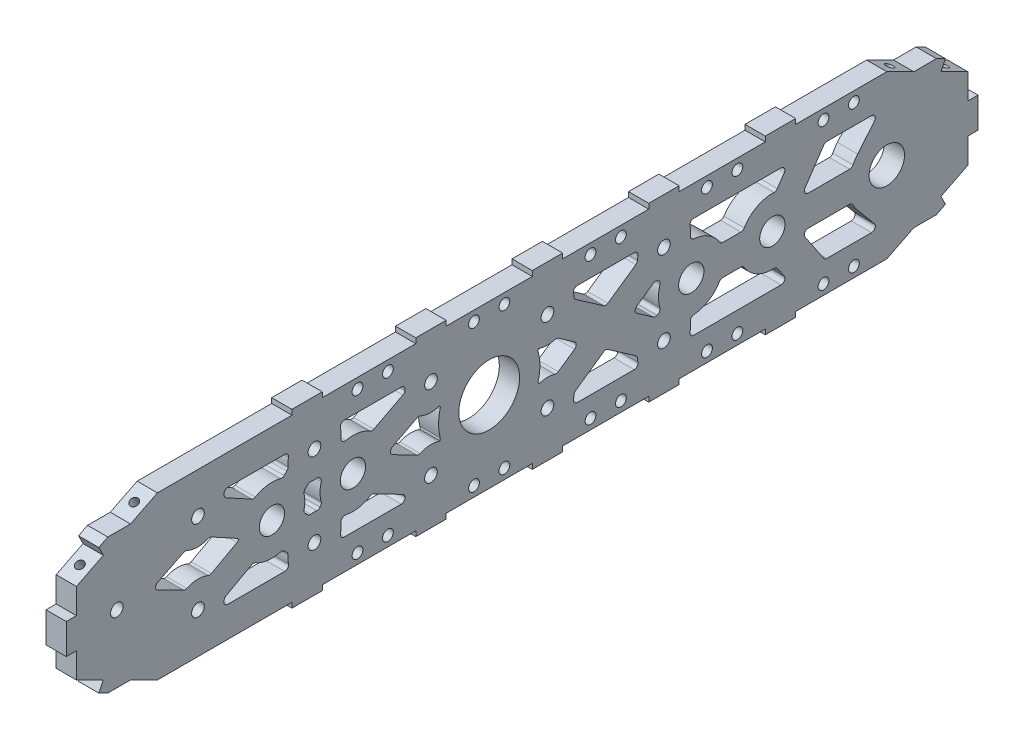
from build123d import *

# Parameters (mm, degrees)
SKETCH1_R                   = 7.9375
BOSS_EXTRUDE1_DEPTH         = 12.7
F_3_8_16_TAPPED_HOLE1_D     = 7.9375
F_3_8_16_TAPPED_HOLE1_DEPTH = 23.876
F_3_8_16_TAPPED_HOLE1_TIP   = 2.384665582
CUT_EXTRUDE3_DEPTH          = 218.842023092
BOSS_EXTRUDE2_DEPTH         = 12.7
CUT_EXTRUDE4_DEPTH          = 218.842023092
SKETCH13_W                  = 25.4
SKETCH13_H                  = 101.6
BOSS_EXTRUDE3_DEPTH         = 12.7
SKETCH14_R                  = 11.1125
CUT_EXTRUDE5_DEPTH          = 352.269809441
F_3_8_16_TAPPED_HOLE2_D     = 7.9375
F_3_8_16_TAPPED_HOLE2_DEPTH = 23.876
F_3_8_16_TAPPED_HOLE2_TIP   = 2.384665582
SKETCH17_R                  = 19.05
CUT_EXTRUDE6_DEPTH          = 352.269809441
F_1_4_CLEARANCE_HOLE1_D     = 6.7564
SKETCH21_W                  = 19.05
SKETCH21_H                  = 3.175
BOSS_EXTRUDE4_DEPTH         = 12.7
SKETCH22_W                  = 6.35
SKETCH22_H                  = 19.05
BOSS_EXTRUDE5_DEPTH         = 12.7
F_1_4_20_TAPPED_HOLE1_D     = 5.1054
F_1_4_20_TAPPED_HOLE1_DEPTH = 22.86
F_1_4_20_TAPPED_HOLE1_TIP   = 1.533816902
F_1_4_20_TAPPED_HOLE2_D     = 5.1054
F_1_4_20_TAPPED_HOLE2_DEPTH = 22.86
F_1_4_20_TAPPED_HOLE2_TIP   = 1.533816902
F_1_4_20_TAPPED_HOLE3_D     = 5.1054
F_1_4_20_TAPPED_HOLE3_DEPTH = 22.86
F_1_4_20_TAPPED_HOLE3_TIP   = 1.533816902
F_1_4_20_TAPPED_HOLE4_D     = 5.1054
F_1_4_20_TAPPED_HOLE4_DEPTH = 22.86
F_1_4_20_TAPPED_HOLE4_TIP   = 1.533816902
CUT_EXTRUDE7_DEPTH          = 359.015004783
FILLET1_R                   = 2.38125
BOSS_EXTRUDE6_DEPTH         = 12.7


with BuildPart() as part:
    # Sketch1 → Boss-Extrude1 (new body)
    with BuildSketch(Plane(origin=(0, 0, 0), x_dir=(0, 0, -1), z_dir=(1, 0, 0))):
        with BuildLine():
            Line((93.345, 0), (55.245, 50.8))
            Line((55.245, 50.8), (-160.655, 50.8))
            ThreePointArc((-160.655, 50.8), (-211.455, 0), (-160.655, -50.8))
            Line((-160.655, -50.8), (55.245, -50.8))
            Line((55.245, -50.8), (93.345, 0))
        make_face()
        with Locations((-88.9, 0)):
            Circle(SKETCH1_R, mode=Mode.SUBTRACT)
        with Locations((-38.1, 0)):
            Circle(SKETCH1_R, mode=Mode.SUBTRACT)
    boss_extrude1 = extrude(amount=BOSS_EXTRUDE1_DEPTH)

    # 3/8-16 Tapped Hole1
    with Locations(Plane(origin=(12.7, 0, 0), x_dir=(0, 0, -1), z_dir=(1, 0, 0))):
        with Locations((61.595, 0), (-62.23, -25.4), (-135.255, -25.4), (-62.23, 25.4), (-135.255, 25.4), (-186.055, 0)):
            Hole(F_3_8_16_TAPPED_HOLE1_D / 2, depth=F_3_8_16_TAPPED_HOLE1_DEPTH)
            with Locations((0, 0, -(F_3_8_16_TAPPED_HOLE1_DEPTH + F_3_8_16_TAPPED_HOLE1_TIP / 2))):  # 118° drill point
                Cone(0, F_3_8_16_TAPPED_HOLE1_D / 2, F_3_8_16_TAPPED_HOLE1_TIP, mode=Mode.SUBTRACT)

    # Sketch10 → Cut-Extrude3 (cut, through all)
    with BuildSketch(Plane(origin=(12.7, 0, 0), x_dir=(0, 0, -1), z_dir=(1, 0, 0))):
        Polygon((-211.455, 25.4), (-160.655, 50.8), (-211.455, 50.8), align=None)
        Polygon((-211.455, -25.4), (-160.655, -50.8), (-211.455, -50.8), align=None)
    cut_extrude3 = extrude(amount=-CUT_EXTRUDE3_DEPTH, mode=Mode.SUBTRACT)

    # Sketch11 → Boss-Extrude2 (add)
    with BuildSketch(Plane(origin=(12.7, 0, 0), x_dir=(0, 0, -1), z_dir=(1, 0, 0))):
        Polygon((-201.295, 30.48), (-211.455, 25.4), (-211.455, -25.4), (-201.295, -30.48), align=None)
    boss_extrude2 = extrude(amount=-BOSS_EXTRUDE2_DEPTH)

    # Sketch12 → Cut-Extrude4 (cut, through all)
    with BuildSketch(Plane.ZY):
        Polygon((-67.945, 33.866666667), (-67.945, -33.866666667), (-93.345, 0), align=None)
    extrude(amount=-CUT_EXTRUDE4_DEPTH, mode=Mode.SUBTRACT)

    # Mirror1: Boss-Extrude1, Cut-Extrude3, Boss-Extrude2 across plane
    add(boss_extrude1.mirror(Plane(origin=(12.7, 33.866666667, -67.945), x_dir=(1, 0, 0), z_dir=(0, 0, 1))))
    add(cut_extrude3.mirror(Plane(origin=(12.7, 33.866666667, -67.945), x_dir=(1, 0, 0), z_dir=(0, 0, 1))), mode=Mode.SUBTRACT)
    add(boss_extrude2.mirror(Plane(origin=(12.7, 33.866666667, -67.945), x_dir=(1, 0, 0), z_dir=(0, 0, 1))))

    # Sketch13 → Boss-Extrude3 (add)
    with BuildSketch(Plane(origin=(12.7, 0, 0), x_dir=(0, 0, -1), z_dir=(1, 0, 0))):
        with Locations((67.945, 0)):
            Rectangle(SKETCH13_W, SKETCH13_H)
    extrude(amount=-BOSS_EXTRUDE3_DEPTH)

    # Sketch14 → Cut-Extrude5 (cut, through all)
    with BuildSketch(Plane.ZY):
        with Locations((-296.545, 0)):
            Circle(SKETCH14_R)
    extrude(amount=-CUT_EXTRUDE5_DEPTH, mode=Mode.SUBTRACT)

    # 3/8-16 Tapped Hole2
    with Locations(Plane(origin=(12.7, 0, 0), x_dir=(0, 0, -1), z_dir=(1, 0, 0))):
        with Locations((10.795, 25.4), (83.82, 25.4), (156.845, 25.4), (10.795, -25.4), (83.82, -25.4), (156.845, -25.4)):
            Hole(F_3_8_16_TAPPED_HOLE2_D / 2, depth=F_3_8_16_TAPPED_HOLE2_DEPTH)
            with Locations((0, 0, -(F_3_8_16_TAPPED_HOLE2_DEPTH + F_3_8_16_TAPPED_HOLE2_TIP / 2))):  # 118° drill point
                Cone(0, F_3_8_16_TAPPED_HOLE2_D / 2, F_3_8_16_TAPPED_HOLE2_TIP, mode=Mode.SUBTRACT)

    # Sketch17 → Cut-Extrude6 (cut, through all)
    with BuildSketch(Plane(origin=(12.7, 0, 0), x_dir=(0, 0, -1), z_dir=(1, 0, 0))):
        with Locations((47.3075, 0)):
            Circle(SKETCH17_R)
    extrude(amount=-CUT_EXTRUDE6_DEPTH, mode=Mode.SUBTRACT)

    # 1/4 Clearance Hole1 (through all)
    with Locations(Plane(origin=(12.7, 0, 0), x_dir=(0, 0, -1), z_dir=(1, 0, 0))):
        with Locations((-35.2425, 44.45), (-16.1925, 44.45), (37.7825, 44.45), (56.8325, 44.45), (110.8075, 44.45), (129.8575, 44.45), (183.8325, 44.45), (202.8825, 44.45), (256.8575, 44.45), (275.9075, 44.45)):
            f_1_4_clearance_hole1 = Hole(F_1_4_CLEARANCE_HOLE1_D / 2)

    # Sketch21 → Boss-Extrude4 (add)
    with BuildSketch(Plane(origin=(12.7, 0, 0), x_dir=(0, 0, -1), z_dir=(1, 0, 0))):
        with Locations((-66.83375, 52.3875)):
            Rectangle(SKETCH21_W, SKETCH21_H)
        with Locations((10.795, 52.3875)):
            Rectangle(SKETCH21_W, SKETCH21_H)
        with Locations((83.82, 52.3875)):
            Rectangle(SKETCH21_W, SKETCH21_H)
        with Locations((156.845, 52.3875)):
            Rectangle(SKETCH21_W, SKETCH21_H)
        with Locations((229.87, 52.3875)):
            Rectangle(SKETCH21_W, SKETCH21_H)
    boss_extrude4 = extrude(amount=-BOSS_EXTRUDE4_DEPTH)

    # Mirror2: 1/4 Clearance Hole1, Boss-Extrude4 across plane
    add(f_1_4_clearance_hole1.mirror(Plane.ZX), mode=Mode.SUBTRACT)
    add(boss_extrude4.mirror(Plane.ZX))

    # Sketch22 → Boss-Extrude5 (add)
    with BuildSketch(Plane(origin=(12.7, 0, 0), x_dir=(0, 0, -1), z_dir=(1, 0, 0))):
        Polygon((-197.414225326, 39.519903166), (-194.574418994, 33.840290503), (-177.535581006, 42.359709497), (-191.734612663, 42.359709497), align=None)
        with Locations((-214.63, 0)):
            Rectangle(SKETCH22_W, SKETCH22_H)
        Polygon((-177.535581006, -42.359709497), (-194.574418994, -33.840290503), (-197.414225326, -39.519903166), (-191.734612663, -42.359709497), align=None)
        Polygon((330.464418994, -33.840290503), (313.425581006, -42.359709497), (327.624612663, -42.359709497), (333.304225326, -39.519903166), align=None)
        with Locations((350.52, 0)):
            Rectangle(SKETCH22_W, SKETCH22_H)
        Polygon((313.425581006, 42.359709497), (330.464418994, 33.840290503), (333.304225326, 39.519903166), (327.624612663, 42.359709497), align=None)
    extrude(amount=-BOSS_EXTRUDE5_DEPTH)

    # 1/4-20 Tapped Hole1
    with Locations(Plane(origin=(0, -104.902, 52.451), x_dir=(-1, 0, 0), z_dir=(0, -0.8944271909999177, 0.4472135954999544))):
        with Locations((-6.35, -130.146876347), (-6.35, -168.246876347)):
            Hole(F_1_4_20_TAPPED_HOLE1_D / 2, depth=F_1_4_20_TAPPED_HOLE1_DEPTH)
            with Locations((0, 0, -(F_1_4_20_TAPPED_HOLE1_DEPTH + F_1_4_20_TAPPED_HOLE1_TIP / 2))):  # 118° drill point
                Cone(0, F_1_4_20_TAPPED_HOLE1_D / 2, F_1_4_20_TAPPED_HOLE1_TIP, mode=Mode.SUBTRACT)

    # 1/4-20 Tapped Hole2
    with Locations(Plane(origin=(0, 104.902, 52.451), x_dir=(1, 0, 0), z_dir=(0, 0.894427190999916, 0.44721359549995787))):
        with Locations((6.35, -130.146876347), (6.35, -168.246876347)):
            Hole(F_1_4_20_TAPPED_HOLE2_D / 2, depth=F_1_4_20_TAPPED_HOLE2_DEPTH)
            with Locations((0, 0, -(F_1_4_20_TAPPED_HOLE2_DEPTH + F_1_4_20_TAPPED_HOLE2_TIP / 2))):  # 118° drill point
                Cone(0, F_1_4_20_TAPPED_HOLE2_D / 2, F_1_4_20_TAPPED_HOLE2_TIP, mode=Mode.SUBTRACT)

    # 1/4-20 Tapped Hole3
    with Locations(Plane(origin=(0, -159.258, -79.629), x_dir=(-1, 0, 0), z_dir=(0, -0.8944271909999177, -0.4472135954999544))):
        with Locations((-6.35, 289.790587332), (-6.35, 251.690587332)):
            Hole(F_1_4_20_TAPPED_HOLE3_D / 2, depth=F_1_4_20_TAPPED_HOLE3_DEPTH)
            with Locations((0, 0, -(F_1_4_20_TAPPED_HOLE3_DEPTH + F_1_4_20_TAPPED_HOLE3_TIP / 2))):  # 118° drill point
                Cone(0, F_1_4_20_TAPPED_HOLE3_D / 2, F_1_4_20_TAPPED_HOLE3_TIP, mode=Mode.SUBTRACT)

    # 1/4-20 Tapped Hole4
    with Locations(Plane(origin=(0, 159.258, -79.629), x_dir=(1, 0, 0), z_dir=(0, 0.894427190999916, -0.44721359549995787))):
        with Locations((6.35, 251.690587332), (6.35, 289.790587332)):
            Hole(F_1_4_20_TAPPED_HOLE4_D / 2, depth=F_1_4_20_TAPPED_HOLE4_DEPTH)
            with Locations((0, 0, -(F_1_4_20_TAPPED_HOLE4_DEPTH + F_1_4_20_TAPPED_HOLE4_TIP / 2))):  # 118° drill point
                Cone(0, F_1_4_20_TAPPED_HOLE4_D / 2, F_1_4_20_TAPPED_HOLE4_TIP, mode=Mode.SUBTRACT)

    # Sketch31 → Cut-Extrude7 (cut, through all)
    with BuildSketch(Plane(origin=(12.7, 0, 0), x_dir=(0, 0, -1), z_dir=(1, 0, 0))):
        with BuildLine():
            Line((-109.532714522, 0.444407153), (-127.835731114, 10.473457341))
            ThreePointArc((-127.835731114, 10.473457341), (-135.568492832, 8.734198225), (-143.230374534, 10.76303899))
            Line((-143.230374534, 10.76303899), (-164.756452514, 0))
            Line((-164.756452514, 0), (-143.230374534, -10.76303899))
            ThreePointArc((-143.230374534, -10.76303899), (-135.568492832, -8.734198225), (-127.835731114, -10.473457341))
            Line((-127.835731114, -10.473457341), (-109.532714522, -0.444407153))
            ThreePointArc((-109.532714522, -0.444407153), (-109.5375, 0), (-109.532714522, 0.444407153))
        make_face()
        with BuildLine():
            Line((-118.681545994, 27.179845185), (-100.378529402, 17.150794997))
            ThreePointArc((-100.378529402, 17.150794997), (-91.572751221, 20.463694856), (-82.211489466, 19.523581461))
            Line((-82.211489466, 19.523581461), (-78.704621926, 22.863455309))
            ThreePointArc((-78.704621926, 22.863455309), (-78.780807786, 27.379390861), (-77.641837222, 31.75))
            Line((-77.641837222, 31.75), (-119.843162778, 31.75))
            ThreePointArc((-119.843162778, 31.75), (-119.099929821, 29.506206774), (-118.681545994, 27.179845185))
        make_face()
        with BuildLine():
            ThreePointArc((-82.211489466, -19.523581461), (-91.572751221, -20.463694856), (-100.378529402, -17.150794997))
            Line((-100.378529402, -17.150794997), (-118.681545994, -27.179845185))
            ThreePointArc((-118.681545994, -27.179845185), (-119.099929821, -29.506206774), (-119.843162778, -31.75))
            Line((-119.843162778, -31.75), (-77.641837222, -31.75))
            ThreePointArc((-77.641837222, -31.75), (-78.780807786, -27.379390861), (-78.704621926, -22.863455309))
            Line((-78.704621926, -22.863455309), (-82.211489466, -19.523581461))
        make_face()
        with BuildLine():
            ThreePointArc((-59.714050552, 8.922220267), (-62.646848791, 8.736463051), (-65.566690891, 9.068627723))
            Line((-65.566690891, 9.068627723), (-69.073558431, 5.728753875))
            ThreePointArc((-69.073558431, 5.728753875), (-68.466270603, 2.892941269), (-68.2625, 0))
            ThreePointArc((-68.2625, 0), (-68.466270603, -2.892941269), (-69.073558431, -5.728753875))
            Line((-69.073558431, -5.728753875), (-65.566690891, -9.068627723))
            ThreePointArc((-65.566690891, -9.068627723), (-62.646848791, -8.736463051), (-59.714050552, -8.922220267))
            Line((-59.714050552, -8.922220267), (-57.615205577, -6.712909767))
            ThreePointArc((-57.615205577, -6.712909767), (-58.7375, 0), (-57.615205577, 6.712909767))
            Line((-57.615205577, 6.712909767), (-59.714050552, 8.922220267))
        make_face()
        with BuildLine():
            Line((-4.616837222, 31.75), (-46.818162778, 31.75))
            ThreePointArc((-46.818162778, 31.75), (-45.87849719, 28.636600444), (-45.56125, 25.4))
            ThreePointArc((-45.56125, 25.4), (-45.646860181, 23.712783265), (-45.902811342, 22.042897516))
            Line((-45.902811342, 22.042897516), (-43.803966367, 19.833587016))
            ThreePointArc((-43.803966367, 19.833587016), (-34.690667805, 20.353939674), (-26.244360173, 16.892312173))
            Line((-26.244360173, 16.892312173), (-5.734959647, 27.546546213))
            ThreePointArc((-5.734959647, 27.546546213), (-5.313595617, 29.684900678), (-4.616837222, 31.75))
        make_face()
        with BuildLine():
            ThreePointArc((-45.56125, -25.4), (-45.87849719, -28.636600444), (-46.818162778, -31.75))
            Line((-46.818162778, -31.75), (-4.616837222, -31.75))
            ThreePointArc((-4.616837222, -31.75), (-5.313595617, -29.684900678), (-5.734959647, -27.546546213))
            Line((-5.734959647, -27.546546213), (-26.244360173, -16.892312173))
            ThreePointArc((-26.244360173, -16.892312173), (-34.690667805, -20.353939674), (-43.803966367, -19.833587016))
            Line((-43.803966367, -19.833587016), (-45.902811342, -22.042897516))
            ThreePointArc((-45.902811342, -22.042897516), (-45.646860181, -23.712783265), (-45.56125, -25.4))
        make_face()
        with BuildLine():
            ThreePointArc((16.58496986, 9.769149876), (9.723175082, 8.765745646), (3.046896581, 10.641472974))
            Line((3.046896581, 10.641472974), (-17.437938894, 0))
            Line((-17.437938894, 0), (3.046896581, -10.641472974))
            ThreePointArc((3.046896581, -10.641472974), (9.723175082, -8.765745646), (16.58496986, -9.769149876))
            Line((16.58496986, -9.769149876), (17.004887279, -9.477033411))
            ThreePointArc((17.004887279, -9.477033411), (15.5575, 0), (17.004887279, 9.477033411))
            Line((17.004887279, 9.477033411), (16.58496986, 9.769149876))
        make_face()
        with BuildLine():
            ThreePointArc((89.60996986, 9.769149876), (83.82, 8.73125), (78.03003014, 9.769149876))
            Line((78.03003014, 9.769149876), (77.610112721, 9.477033411))
            ThreePointArc((77.610112721, 9.477033411), (78.693567402, 4.79346149), (79.0575, 0))
            ThreePointArc((79.0575, 0), (78.693567402, -4.79346149), (77.610112721, -9.477033411))
            Line((77.610112721, -9.477033411), (78.03003014, -9.769149876))
            ThreePointArc((78.03003014, -9.769149876), (83.82, -8.73125), (89.60996986, -9.769149876))
            Line((89.60996986, -9.769149876), (103.653122807, 0))
            Line((103.653122807, 0), (89.60996986, 9.769149876))
        make_face()
        with BuildLine():
            Line((141.433162778, 31.75), (99.231837222, 31.75))
            ThreePointArc((99.231837222, 31.75), (100.170784557, 28.640226987), (100.48874836, 25.40739397))
            Line((100.48874836, 25.40739397), (120.3325, 11.603045004))
            Line((120.3325, 11.603045004), (140.17625164, 25.40739397))
            ThreePointArc((140.17625164, 25.40739397), (140.494215443, 28.640226987), (141.433162778, 31.75))
        make_face()
        with BuildLine():
            ThreePointArc((100.48874836, -25.40739397), (100.170784557, -28.640226987), (99.231837222, -31.75))
            Line((99.231837222, -31.75), (141.433162778, -31.75))
            ThreePointArc((141.433162778, -31.75), (140.494215443, -28.640226987), (140.17625164, -25.40739397))
            Line((140.17625164, -25.40739397), (120.3325, -11.603045004))
            Line((120.3325, -11.603045004), (100.48874836, -25.40739397))
        make_face()
        with BuildLine():
            ThreePointArc((155.323153896, 8.800867161), (153.157174621, 9.144318823), (151.05503014, 9.769149876))
            Line((151.05503014, 9.769149876), (137.011877193, 0))
            Line((137.011877193, 0), (151.05503014, -9.769149876))
            ThreePointArc((151.05503014, -9.769149876), (153.157174621, -9.144318823), (155.323153896, -8.800867161))
            ThreePointArc((155.323153896, -8.800867161), (153.3525, 0), (155.323153896, 8.800867161))
        make_face()
        with BuildLine():
            ThreePointArc((173.51375, -25.4), (173.19650281, -28.636600444), (172.256837222, -31.75))
            Line((172.256837222, -31.75), (234.729405592, -31.75))
            Line((234.729405592, -31.75), (227.138013585, -20.503493323))
            ThreePointArc((227.138013585, -20.503493323), (215.104357709, -18.22346673), (206.482056881, -9.525))
            Line((206.482056881, -9.525), (192.297943119, -9.525))
            ThreePointArc((192.297943119, -9.525), (184.188795226, -17.941320525), (172.808784838, -20.603668047))
            ThreePointArc((172.808784838, -20.603668047), (173.336567013, -22.976068479), (173.51375, -25.4))
        make_face()
        with BuildLine():
            Line((234.729405592, 31.75), (172.256837222, 31.75))
            ThreePointArc((172.256837222, 31.75), (173.19650281, 28.636600444), (173.51375, 25.4))
            ThreePointArc((173.51375, 25.4), (173.336567013, 22.976068479), (172.808784838, 20.603668047))
            ThreePointArc((172.808784838, 20.603668047), (184.188795226, 17.941320525), (192.297943119, 9.525))
            Line((192.297943119, 9.525), (206.482056881, 9.525))
            ThreePointArc((206.482056881, 9.525), (215.104357709, 18.22346673), (227.138013585, 20.503493323))
            Line((227.138013585, 20.503493323), (234.729405592, 31.75))
        make_face()
        with BuildLine():
            Line((292.047905029, 31.75), (257.713094408, 31.75))
            Line((257.713094408, 31.75), (254.116033621, 26.421021056))
            Line((254.116033621, 26.421021056), (242.927580827, 9.845535435))
            ThreePointArc((242.927580827, 9.845535435), (243.01346673, 9.685642291), (243.097943119, 9.525))
            Line((243.097943119, 9.525), (274.720483253, 9.525))
            ThreePointArc((274.720483253, 9.525), (276.292569345, 12.524943465), (278.274361904, 15.27150745))
            Line((278.274361904, 15.27150745), (292.047905029, 31.75))
        make_face()
        with BuildLine():
            Line((254.116033621, -26.421021056), (257.713094408, -31.75))
            Line((257.713094408, -31.75), (292.047905029, -31.75))
            Line((292.047905029, -31.75), (278.274361904, -15.27150745))
            ThreePointArc((278.274361904, -15.27150745), (276.292569345, -12.524943465), (274.720483253, -9.525))
            Line((274.720483253, -9.525), (243.097943119, -9.525))
            ThreePointArc((243.097943119, -9.525), (243.01346673, -9.685642291), (242.927580827, -9.845535435))
            Line((242.927580827, -9.845535435), (254.116033621, -26.421021056))
        make_face()
    extrude(amount=-CUT_EXTRUDE7_DEPTH, mode=Mode.SUBTRACT)

    # Fillet1
    # the kernel refuses this fillet: 2.38125 mm, written as the material it adds along each edge
    with BuildSketch(Plane(origin=(12.7, -31.75, -292.047905029), x_dir=(0, 0, 1), z_dir=(-1, 0, 0)), Plane(origin=(12.7, 31.75, -292.047905029), x_dir=(0, -0.7672708911870568, 0.6413231475138095), z_dir=(-1, 0, 0))) as fillet1_piece_1:
        with BuildLine():
            CenterArc((FILLET1_R * 2.13917035869, FILLET1_R), FILLET1_R, 140.109445819, 129.890554181)
            Line((FILLET1_R * 1.3718994675, FILLET1_R * 1.64132314751), (0, 0))
            Line((0, 0), (FILLET1_R * 2.13917035869, 0))
        make_face()
    fillet1_piece_1_solid = extrude(amount=12.7, mode=Mode.PRIVATE)
    with BuildSketch(Plane(origin=(12.7, -31.75, -257.713094408), x_dir=(0, 0.8288486740756631, 0.5594728550010406), z_dir=(-1, 0, 0)), Plane(origin=(12.7, 31.75, -257.713094408), x_dir=(0, 0, -1), z_dir=(-1, 0, 0))) as fillet1_piece_2:
        with BuildLine():
            CenterArc((FILLET1_R * 0.531492851201, FILLET1_R), FILLET1_R, 214.01934999, 55.98065001)
            Line((-FILLET1_R * 0.297355822874, FILLET1_R * 0.440527144999), (0, 0))
            Line((0, 0), (FILLET1_R * 0.531492851201, 0))
        make_face()
    fillet1_piece_2_solid = extrude(amount=12.7, mode=Mode.PRIVATE)
    with BuildSketch(Plane(origin=(12.7, -9.525, -274.720483253), x_dir=(0, -0.9040308152496038, -0.42746729123891664), z_dir=(-1, 0, 0))) as fillet1_piece_3:
        with BuildLine():
            CenterArc((1.508584437, 2.380166162), FILLET1_R, 205.306935134, 62.964308211)
            Line((-0.644138942, 1.362259674), (0, 0))
            ThreePointArc((0, 0), (0.718373541, 0.010838384), (1.436747083, 0))
        make_face()
    fillet1_piece_3_solid = extrude(amount=12.7, mode=Mode.PRIVATE)
    with BuildSketch(Plane(origin=(12.7, 9.525, -274.720483253), x_dir=(0, 0, 1), z_dir=(-1, 0, 0))) as fillet1_piece_4:
        with BuildLine():
            CenterArc((1.506873053, 2.38125), FILLET1_R, 207.035691789, 62.964308211)
            ThreePointArc((-0.614162384, 1.298863636), (-0.297282959, 0.654064873), (0, 0))
            Line((0, 0), (1.506873053, 0))
        make_face()
    fillet1_piece_4_solid = extrude(amount=12.7, mode=Mode.PRIVATE)
    with BuildSketch(Plane(origin=(12.7, -20.503493323, -227.138013585), x_dir=(0, -0.8288486740755918, -0.559472855001146), z_dir=(-1, 0, 0)), Plane(origin=(12.7, -9.525, -192.297943119), x_dir=(0, 0, -1), z_dir=(-1, 0, 0)), Plane(origin=(12.7, 9.525, -206.482056881), x_dir=(0, 0, 1), z_dir=(-1, 0, 0)), Plane(origin=(12.7, -16.892312173, 26.244360173), x_dir=(0, -0.4609898282275169, -0.8874054193381763), z_dir=(-1, 0, 0)), Plane(origin=(12.7, 19.833587016, 43.803966367), x_dir=(0, 0.7249994335945086, 0.6887494619145932), z_dir=(-1, 0, 0)), Plane(origin=(12.7, 5.728753875, 69.073558431), x_dir=(0, 0.6896551724137234, -0.7241379310345492), z_dir=(-1, 0, 0)), Plane(origin=(12.7, -6.712909767, 57.615205577), x_dir=(0, -0.7249994335943665, 0.6887494619147428), z_dir=(-1, 0, 0)), Plane(origin=(12.7, -19.523581461, 82.211489466), x_dir=(0, -0.6896551724139569, -0.7241379310343268), z_dir=(-1, 0, 0)), Plane(origin=(12.7, 17.150794997, 100.378529402), x_dir=(0, 0.48053465196479356, 0.8769757398360999), z_dir=(-1, 0, 0)), Plane(origin=(12.7, -0.444407153, 109.532714522), x_dir=(0, -0.4805346519648791, 0.8769757398360529), z_dir=(-1, 0, 0))) as fillet1_piece_5:
        with BuildLine():
            CenterArc((1.392413794, 2.38125), FILLET1_R, 211.147389922, 58.852610078)
            ThreePointArc((-0.645554163, 1.149568966), (-0.313594712, 0.579940952), (0, 0))
            Line((0, 0), (1.392413794, 0))
        make_face()
    fillet1_piece_5_solid = extrude(amount=12.7, mode=Mode.PRIVATE)
    with BuildSketch(Plane(origin=(12.7, -31.75, -234.729405592), x_dir=(0, 0, 1), z_dir=(-1, 0, 0)), Plane(origin=(12.7, 31.75, -234.729405592), x_dir=(0, -0.8288486740756463, 0.5594728550010654), z_dir=(-1, 0, 0))) as fillet1_piece_6:
        with BuildLine():
            CenterArc((FILLET1_R * 1.8814928512, FILLET1_R), FILLET1_R, 145.98065001, 124.01934999)
            Line((FILLET1_R * 1.05264417713, FILLET1_R * 1.559472855), (0, 0))
            Line((0, 0), (FILLET1_R * 1.8814928512, 0))
        make_face()
    fillet1_piece_6_solid = extrude(amount=12.7, mode=Mode.PRIVATE)
    with BuildSketch(Plane(origin=(12.7, -31.75, -141.433162778), x_dir=(0, 0, 1), z_dir=(-1, 0, 0)), Plane(origin=(12.7, 31.75, -172.256837222), x_dir=(0, 0, -1), z_dir=(-1, 0, 0)), Plane(origin=(12.7, 31.75, -99.231837222), x_dir=(0, 0, -1), z_dir=(-1, 0, 0)), Plane(origin=(12.7, -31.75, 4.616837222), x_dir=(0, 0, 1), z_dir=(-1, 0, 0)), Plane(origin=(12.7, -31.75, 77.641837222), x_dir=(0, 0, 1), z_dir=(-1, 0, 0)), Plane(origin=(12.7, 31.75, 46.818162778), x_dir=(0, 0, -1), z_dir=(-1, 0, 0)), Plane(origin=(12.7, 31.75, 119.843162778), x_dir=(0, 0, -1), z_dir=(-1, 0, 0))) as fillet1_piece_7:
        with BuildLine():
            CenterArc((3.220165446, 2.38125), FILLET1_R, 167.975300819, 102.024699181)
            ThreePointArc((0.891165113, 2.87734375), (0.510710903, 1.418500455), (0, 0))
            Line((0, 0), (3.220165446, 0))
        make_face()
    fillet1_piece_7_solid = extrude(amount=12.7, mode=Mode.PRIVATE)
    with BuildSketch(Plane(origin=(12.7, -31.75, -172.256837222), x_dir=(0, 0.9552334833213638, -0.29585299109817026), z_dir=(-1, 0, 0)), Plane(origin=(12.7, -31.75, -99.231837222), x_dir=(0, 0.9552334833213716, -0.29585299109814467), z_dir=(-1, 0, 0)), Plane(origin=(12.7, -31.75, 119.843162778), x_dir=(0, 0.9552334833213704, -0.29585299109814867), z_dir=(-1, 0, 0))) as fillet1_piece_8:
        with BuildLine():
            CenterArc((3.227345311, 2.371509921), FILLET1_R, 162.791306507, 102.024699181)
            Line((0.952695579, 3.076009856), (0, 0))
            ThreePointArc((0, 0), (1.506094479, 0.068180552), (3.012188957, 0))
        make_face()
    fillet1_piece_8_solid = extrude(amount=12.7, mode=Mode.PRIVATE)
    with BuildSketch(Plane(origin=(12.7, -9.525, -206.482056881), x_dir=(0, -0.8719248168343995, -0.48963977962201854), z_dir=(-1, 0, 0)), Plane(origin=(12.7, 9.525, -192.297943119), x_dir=(0, 0.8719248168344608, 0.4896397796219093), z_dir=(-1, 0, 0)), Plane(origin=(12.7, -19.833587016, 43.803966367), x_dir=(0, -0.24554918553346233, -0.9693841330885571), z_dir=(-1, 0, 0)), Plane(origin=(12.7, 16.892312173, 26.244360173), x_dir=(0, 0.5480318498129968, 0.8364574654999171), z_dir=(-1, 0, 0)), Plane(origin=(12.7, 6.712909767, 57.615205577), x_dir=(0, -0.9555263113160184, 0.2949058635951538), z_dir=(-1, 0, 0)), Plane(origin=(12.7, -5.728753875, 69.073558431), x_dir=(0, 0.9690764395159748, -0.24676072291805543), z_dir=(-1, 0, 0)), Plane(origin=(12.7, 19.523581461, 82.211489466), x_dir=(0, 0.29371122624409274, 0.9558941968534966), z_dir=(-1, 0, 0)), Plane(origin=(12.7, 0.444407153, 109.532714522), x_dir=(0, -0.99994579241359, -0.010412119590042073), z_dir=(-1, 0, 0))) as fillet1_piece_9:
        with BuildLine():
            CenterArc((1.394489787, 2.380034867), FILLET1_R, 209.316908086, 58.852610078)
            Line((-0.681781183, 1.214080142), (0, 0))
            ThreePointArc((0, 0), (0.659213354, 0.010531148), (1.318426708, 0))
        make_face()
    fillet1_piece_9_solid = extrude(amount=12.7, mode=Mode.PRIVATE)
    with BuildSketch(Plane(origin=(12.7, -8.800867161, -155.323153896), x_dir=(0, -0.17208024863893095, 0.9850829345940186), z_dir=(-1, 0, 0)), Plane(origin=(12.7, 20.603668047, -172.808784838), x_dir=(0, 0.977956648899782, -0.2088080287553819), z_dir=(-1, 0, 0))) as fillet1_piece_10:
        with BuildLine():
            CenterArc((2.908367743, 2.373343163), FILLET1_R, 172.300374595, 93.029196584)
            ThreePointArc((0.548586913, 2.692382339), (0.319151607, 1.337051088), (0, 0))
            ThreePointArc((0, 0), (1.35723828, 0.055347856), (2.71447656, 0))
        make_face()
    fillet1_piece_10_solid = extrude(amount=12.7, mode=Mode.PRIVATE)
    with BuildSketch(Plane(origin=(12.7, -20.603668047, -172.808784838), x_dir=(0, -0.9779566488997822, -0.20880802875538138), z_dir=(-1, 0, 0))) as fillet1_piece_11:
        with BuildLine():
            CenterArc((2.908367743, -2.373343163), FILLET1_R, 94.670428821, 93.029196584)
            ThreePointArc((0.548586913, -2.692382339), (0.319151607, -1.337051088), (0, 0))
            ThreePointArc((0, 0), (1.35723828, -0.055347856), (2.71447656, 0))
        make_face()
    fillet1_piece_11_solid = extrude(amount=12.7, mode=Mode.PRIVATE)
    with BuildSketch(Plane(origin=(12.7, 8.800867161, -155.323153896), x_dir=(0, -0.9308936154722882, 0.3652904004664394), z_dir=(-1, 0, 0))) as fillet1_piece_12:
        with BuildLine():
            CenterArc((2.906224036, 2.375967709), FILLET1_R, 173.153764473, 93.029196584)
            ThreePointArc((0.541953212, 2.659825128), (0.325210125, 1.318862202), (0, 0))
            ThreePointArc((0, 0), (1.373851362, 0.045779851), (2.747702725, 0))
        make_face()
    fillet1_piece_12_solid = extrude(amount=12.7, mode=Mode.PRIVATE)
    with BuildSketch(Plane(origin=(12.7, 20.503493323, -227.138013585), x_dir=(0, 0.8288486740755935, -0.5594728550011436), z_dir=(-1, 0, 0)), Plane(origin=(12.7, -17.150794997, 100.378529402), x_dir=(0, -0.4805346519647998, 0.8769757398360964), z_dir=(-1, 0, 0))) as fillet1_piece_13:
        with BuildLine():
            CenterArc((1.392413794, -2.38125), FILLET1_R, 90, 58.852610078)
            ThreePointArc((-0.645554163, -1.149568966), (-0.313594712, -0.579940952), (0, 0))
            Line((0, 0), (1.392413794, 0))
        make_face()
    fillet1_piece_13_solid = extrude(amount=12.7, mode=Mode.PRIVATE)
    with BuildSketch(Plane(origin=(12.7, 31.75, -141.433162778), x_dir=(0, 0, 1), z_dir=(-1, 0, 0)), Plane(origin=(12.7, -31.75, 46.818162778), x_dir=(0, 0, -1), z_dir=(-1, 0, 0)), Plane(origin=(12.7, 31.75, 77.641837222), x_dir=(0, 0, 1), z_dir=(-1, 0, 0)), Plane(origin=(12.7, 31.75, 4.616837222), x_dir=(0, 0, 1), z_dir=(-1, 0, 0))) as fillet1_piece_14:
        with BuildLine():
            CenterArc((3.220165446, -2.38125), FILLET1_R, 90, 102.024699181)
            ThreePointArc((0.891165113, -2.87734375), (0.510710903, -1.418500455), (0, 0))
            Line((0, 0), (3.220165446, 0))
        make_face()
    fillet1_piece_14_solid = extrude(amount=12.7, mode=Mode.PRIVATE)
    with BuildSketch(Plane(origin=(12.7, -9.769149876, -151.05503014), x_dir=(0, 0.571064488198641, 0.8209052017854584), z_dir=(-1, 0, 0)), Plane(origin=(12.7, -25.40739397, -100.48874836), x_dir=(0, 0.5710644881984873, -0.8209052017855654), z_dir=(-1, 0, 0)), Plane(origin=(12.7, 25.40739397, -140.17625164), x_dir=(0, -0.571064488198416, 0.8209052017856148), z_dir=(-1, 0, 0)), Plane(origin=(12.7, 9.769149876, -89.60996986), x_dir=(0, -0.571064488198644, -0.8209052017854562), z_dir=(-1, 0, 0)), Plane(origin=(12.7, -9.769149876, -78.03003014), x_dir=(0, 0.5710644881986521, 0.8209052017854508), z_dir=(-1, 0, 0)), Plane(origin=(12.7, -10.641472974, -3.046896581), x_dir=(0, 0.4609898282279081, 0.8874054193379731), z_dir=(-1, 0, 0)), Plane(origin=(12.7, 9.769149876, -16.58496986), x_dir=(0, -0.5710644881986464, -0.8209052017854547), z_dir=(-1, 0, 0)), Plane(origin=(12.7, -22.042897516, 45.902811342), x_dir=(0, 0.7249994335945681, -0.6887494619145307), z_dir=(-1, 0, 0)), Plane(origin=(12.7, 27.546546213, 5.734959647), x_dir=(0, -0.4609898282276258, 0.8874054193381198), z_dir=(-1, 0, 0)), Plane(origin=(12.7, 8.922220267, 59.714050552), x_dir=(0, -0.7249994335943312, -0.68874946191478), z_dir=(-1, 0, 0)), Plane(origin=(12.7, -9.068627723, 65.566690891), x_dir=(0, 0.6896551724139096, 0.7241379310343719), z_dir=(-1, 0, 0)), Plane(origin=(12.7, -27.179845185, 118.681545994), x_dir=(0, 0.4805346519648355, -0.8769757398360767), z_dir=(-1, 0, 0)), Plane(origin=(12.7, 22.863455309, 78.704621926), x_dir=(0, -0.6896551724137756, 0.7241379310344995), z_dir=(-1, 0, 0)), Plane(origin=(12.7, -10.76303899, 143.230374534), x_dir=(0, 0.4472135954997826, 0.8944271910000036), z_dir=(-1, 0, 0)), Plane(origin=(12.7, 10.473457341, 127.835731114), x_dir=(0, -0.48053465196492456, -0.876975739836028), z_dir=(-1, 0, 0))) as fillet1_piece_15:
        with BuildLine():
            CenterArc((1.191661682, 2.38125), FILLET1_R, 218.682187453, 51.317812547)
            ThreePointArc((-0.667201004, 0.89296875), (-0.326133923, 0.452063192), (0, 0))
            Line((0, 0), (1.191661682, 0))
        make_face()
    fillet1_piece_15_solid = extrude(amount=12.7, mode=Mode.PRIVATE)
    with BuildSketch(Plane(origin=(12.7, 9.769149876, -151.05503014), x_dir=(0, -0.571064488198641, 0.8209052017854584), z_dir=(-1, 0, 0)), Plane(origin=(12.7, -25.40739397, -140.17625164), x_dir=(0, 0.5710644881984182, 0.8209052017856135), z_dir=(-1, 0, 0)), Plane(origin=(12.7, -9.769149876, -89.60996986), x_dir=(0, 0.5710644881986451, -0.8209052017854557), z_dir=(-1, 0, 0)), Plane(origin=(12.7, -9.769149876, -16.58496986), x_dir=(0, 0.5710644881986519, -0.8209052017854509), z_dir=(-1, 0, 0)), Plane(origin=(12.7, 9.068627723, 65.566690891), x_dir=(0, -0.6896551724139096, 0.7241379310343719), z_dir=(-1, 0, 0)), Plane(origin=(12.7, -10.473457341, 127.835731114), x_dir=(0, 0.48053465196493694, -0.8769757398360213), z_dir=(-1, 0, 0))) as fillet1_piece_16:
        with BuildLine():
            CenterArc((1.191661682, -2.38125), FILLET1_R, 90, 51.317812547)
            ThreePointArc((-0.667201004, -0.89296875), (-0.326133923, -0.452063192), (0, 0))
            Line((0, 0), (1.191661682, 0))
        make_face()
    fillet1_piece_16_solid = extrude(amount=12.7, mode=Mode.PRIVATE)
    with BuildSketch(Plane(origin=(12.7, 0, -137.011877193), x_dir=(0, 0.5710644881986024, -0.8209052017854852), z_dir=(-1, 0, 0)), Plane(origin=(12.7, 0, -103.653122807), x_dir=(0, -0.5710644881985985, 0.8209052017854881), z_dir=(-1, 0, 0))) as fillet1_piece_17:
        with BuildLine():
            CenterArc((FILLET1_R * 1.4375, FILLET1_R), FILLET1_R, 159.648978314, 110.351021686)
            Line((FILLET1_R * 0.499920382166, FILLET1_R * 1.34777070064), (0, 0))
            Line((0, 0), (FILLET1_R * 1.4375, 0))
        make_face()
    fillet1_piece_17_solid = extrude(amount=12.7, mode=Mode.PRIVATE)
    with BuildSketch(Plane(origin=(12.7, -11.603045004, -120.3325), x_dir=(0, -0.5710644881986002, -0.8209052017854869), z_dir=(-1, 0, 0)), Plane(origin=(12.7, 11.603045004, -120.3325), x_dir=(0, 0.5710644881985933, 0.8209052017854916), z_dir=(-1, 0, 0))) as fillet1_piece_18:
        with BuildLine():
            CenterArc((FILLET1_R * 0.695652173913, FILLET1_R), FILLET1_R, 200.351021686, 69.648978314)
            Line((-FILLET1_R * 0.241927443921, FILLET1_R * 0.652229299363), (0, 0))
            Line((0, 0), (FILLET1_R * 0.695652173913, 0))
        make_face()
    fillet1_piece_18_solid = extrude(amount=12.7, mode=Mode.PRIVATE)
    with BuildSketch(Plane(origin=(12.7, 25.40739397, -100.48874836), x_dir=(0, 0.9994259054712948, 0.03388007486535841), z_dir=(-1, 0, 0)), Plane(origin=(12.7, 9.769149876, -78.03003014), x_dir=(0, -0.3158057797360612, -0.9488238558791079), z_dir=(-1, 0, 0)), Plane(origin=(12.7, 10.641472974, -3.046896581), x_dir=(0, -0.43496326211125746, -0.9004481998502376), z_dir=(-1, 0, 0)), Plane(origin=(12.7, -27.546546213, 5.734959647), x_dir=(0, -0.9868132385120781, -0.16186300472098145), z_dir=(-1, 0, 0)), Plane(origin=(12.7, 22.042897516, 45.902811342), x_dir=(0, 0.9856953672241701, -0.168536770565976), z_dir=(-1, 0, 0)), Plane(origin=(12.7, -8.922220267, 59.714050552), x_dir=(0, 0.11780003457074799, 0.9930373365866616), z_dir=(-1, 0, 0)), Plane(origin=(12.7, -22.863455309, 78.704621926), x_dir=(0, -0.9928893108489901, 0.11904123824044083), z_dir=(-1, 0, 0)), Plane(origin=(12.7, 27.179845185, 118.681545994), x_dir=(0, 0.9901567001887085, 0.13996324185802564), z_dir=(-1, 0, 0)), Plane(origin=(12.7, 10.76303899, 143.230374534), x_dir=(0, -0.4488340565582369, -0.8936151239059672), z_dir=(-1, 0, 0))) as fillet1_piece_19:
        with BuildLine():
            CenterArc((1.194318679, 2.37991849), FILLET1_R, 216.766046016, 51.317812547)
            Line((-0.713267876, 0.954623748), (0, 0))
            ThreePointArc((0, 0), (0.557348717, 0.009320569), (1.114697433, 0))
        make_face()
    fillet1_piece_19_solid = extrude(amount=12.7, mode=Mode.PRIVATE)
    with BuildSketch(Plane(origin=(12.7, 9.477033411, -77.610112721), x_dir=(0, 0.5710644881985727, -0.820905201785506), z_dir=(-1, 0, 0)), Plane(origin=(12.7, -9.477033411, -17.004887279), x_dir=(0, -0.571064488198592, 0.8209052017854924), z_dir=(-1, 0, 0))) as fillet1_piece_20:
        with BuildLine():
            CenterArc((1.699669021, 2.38125), FILLET1_R, 200.416210129, 69.583789871)
            ThreePointArc((-0.531998793, 1.550581395), (-0.255990335, 0.77872477), (0, 0))
            Line((0, 0), (1.699669021, 0))
        make_face()
    fillet1_piece_20_solid = extrude(amount=12.7, mode=Mode.PRIVATE)
    with BuildSketch(Plane(origin=(12.7, -9.477033411, -77.610112721), x_dir=(0, 0.9618006609725563, -0.2737507781774396), z_dir=(-1, 0, 0)), Plane(origin=(12.7, 9.477033411, -17.004887279), x_dir=(0, -0.9618006609725603, 0.27375077817742527), z_dir=(-1, 0, 0))) as fillet1_piece_21:
        with BuildLine():
            CenterArc((1.70078036, 2.380456366), FILLET1_R, 198.936906626, 69.583789871)
            Line((-0.551588088, 1.607677008), (0, 0))
            ThreePointArc((0, 0), (0.819653186, 0.010581785), (1.639306371, 0))
        make_face()
    fillet1_piece_21_solid = extrude(amount=12.7, mode=Mode.PRIVATE)
    with BuildSketch(Plane(origin=(12.7, 0, 17.437938894), x_dir=(0, 0.46098982822760004, -0.8874054193381331), z_dir=(-1, 0, 0))) as fillet1_piece_22:
        with BuildLine():
            CenterArc((FILLET1_R * 1.925, FILLET1_R), FILLET1_R, 144.901995542, 125.098004458)
            Line((FILLET1_R * 1.10683025634, FILLET1_R * 1.57497675654), (0, 0))
            Line((0, 0), (FILLET1_R * 1.925, 0))
        make_face()
    fillet1_piece_22_solid = extrude(amount=12.7, mode=Mode.PRIVATE)
    with BuildSketch(Plane(origin=(12.7, 0, 164.756452514), x_dir=(0, 0.44721359549995765, -0.8944271909999161), z_dir=(-1, 0, 0))) as fillet1_piece_23:
        with BuildLine():
            CenterArc((FILLET1_R * 2, FILLET1_R), FILLET1_R, 143.130102354, 126.869897646)
            Line((FILLET1_R * 1.2, FILLET1_R * 1.6), (0, 0))
            Line((0, 0), (FILLET1_R * 2, 0))
        make_face()
    fillet1_piece_23_solid = extrude(amount=12.7, mode=Mode.PRIVATE)
    add([fillet1_piece_1_solid, fillet1_piece_2_solid, fillet1_piece_3_solid, fillet1_piece_4_solid, fillet1_piece_5_solid, fillet1_piece_6_solid, fillet1_piece_7_solid, fillet1_piece_8_solid, fillet1_piece_9_solid, fillet1_piece_10_solid, fillet1_piece_11_solid, fillet1_piece_12_solid, fillet1_piece_13_solid, fillet1_piece_14_solid, fillet1_piece_15_solid, fillet1_piece_16_solid, fillet1_piece_17_solid, fillet1_piece_18_solid, fillet1_piece_19_solid, fillet1_piece_20_solid, fillet1_piece_21_solid, fillet1_piece_22_solid, fillet1_piece_23_solid])

    # Sketch32 → Boss-Extrude6 (add)
    with BuildSketch(Plane(origin=(12.7, 0, 0), x_dir=(0, 0, -1), z_dir=(1, 0, 0))):
        with BuildLine():
            Line((245.217828545, 13.238495018), (242.927580827, 9.845535435))
            ThreePointArc((242.927580827, 9.845535435), (243.01346673, 9.685642291), (243.097943119, 9.525))
            Line((243.097943119, 9.525), (247.19152426, 9.525))
            ThreePointArc((247.19152426, 9.525), (245.08881648, 10.78867604), (245.217828545, 13.238495018))
        make_face()
        with BuildLine():
            Line((247.19152426, -9.525), (243.097943119, -9.525))
            ThreePointArc((243.097943119, -9.525), (243.01346673, -9.685642291), (242.927580827, -9.845535435))
            Line((242.927580827, -9.845535435), (245.217828184, -13.238494483))
            ThreePointArc((245.217828184, -13.238494483), (245.088816632, -10.788675755), (247.19152426, -9.525))
        make_face()
    extrude(amount=-BOSS_EXTRUDE6_DEPTH)


solid = part.part
